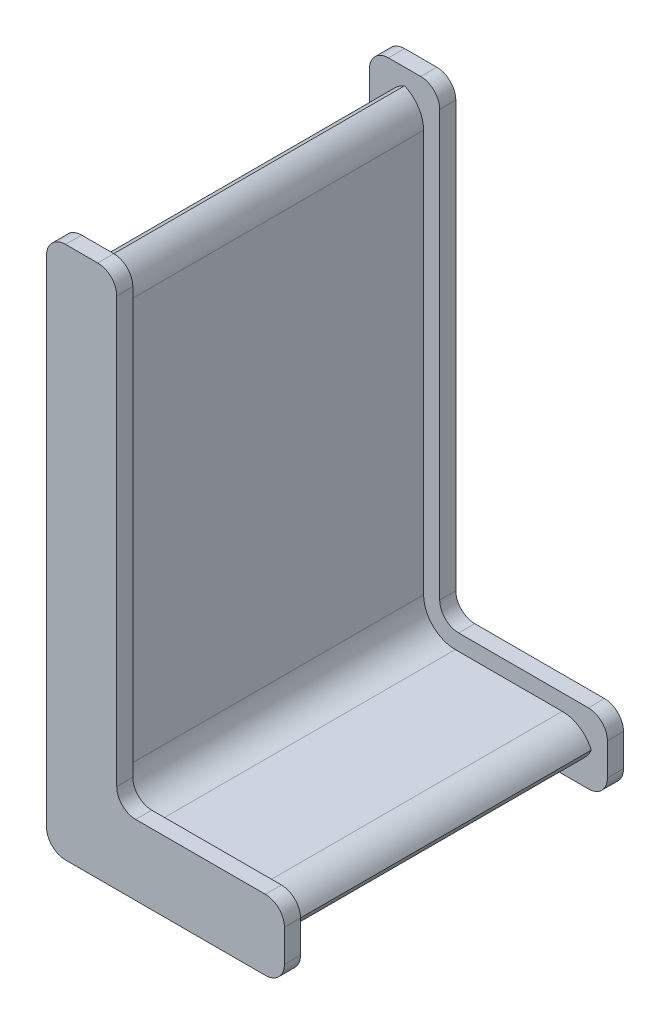
from build123d import *

# Parameters (mm, degrees)
BOSS_EXTRUDE1_DEPTH = 48.42
BOSS_EXTRUDE2_DEPTH = 2.54
BOSS_EXTRUDE3_DEPTH = 2.54
FILLET1_R           = 3


with BuildPart() as part:
    # Sketch2 → Boss-Extrude1 (new body)
    with BuildSketch(Plane.XY):
        with BuildLine():
            Line((0, 5), (0, 74.46))
            ThreePointArc((0, 74.46), (0.816699867, 77.198612788), (3, 79.042575695))
            ThreePointArc((3, 79.042575695), (5.183300133, 77.198612788), (6, 74.46))
            Line((6, 74.46), (6, 11))
            ThreePointArc((6, 11), (7.464466094, 7.464466094), (11, 6))
            Line((11, 6), (27.877424305, 6))
            ThreePointArc((27.877424305, 6), (30.616037093, 5.183300133), (32.46, 3))
            ThreePointArc((32.46, 3), (30.616037093, 0.816699867), (27.877424305, 0))
            Line((27.877424305, 0), (6, 0))
            Line((6, 0), (5, 0))
            ThreePointArc((5, 0), (1.464466094, 1.464466094), (0, 5))
        make_face()
    extrude(amount=BOSS_EXTRUDE1_DEPTH)

    # Sketch3 → Boss-Extrude2 (add)
    with BuildSketch(Plane.XY.offset(48.42)):
        Polygon((-2.54, 81.582575695), (8.54, 81.582575695), (8.54, 8.54), (35, 8.54), (35, -2.54), (-2.54, -2.54), align=None)
    extrude(amount=BOSS_EXTRUDE2_DEPTH)

    # Sketch4 → Boss-Extrude3 (add)
    with BuildSketch(Plane(origin=(0, 0, 0), x_dir=(-1, 0, 0), z_dir=(0, 0, -1))):
        Polygon((-35, -2.54), (2.54, -2.54), (2.54, 81.582575695), (-8.54, 81.582575695), (-8.54, 8.54), (-35, 8.54), align=None)
    extrude(amount=BOSS_EXTRUDE3_DEPTH)

    # Fillet1
    fillet1_edges = [part.edges().sort_by_distance(p)[0] for p in [
        (35, 8.54, -1.27),
        (35, -2.54, -1.27),
        (-2.54, -2.54, -1.27),
        (8.54, 8.54, -1.27),
        (8.54, 81.582575695, -1.27),
        (-2.54, 81.582575695, -1.27),
        (-2.54, 81.582575695, 49.69),
        (8.54, 81.582575695, 49.69),
        (8.54, 8.54, 49.69),
        (35, 8.54, 49.69),
        (35, -2.54, 49.69),
        (-2.54, -2.54, 49.69),
    ]]
    fillet(fillet1_edges, radius=FILLET1_R)


solid = part.part
